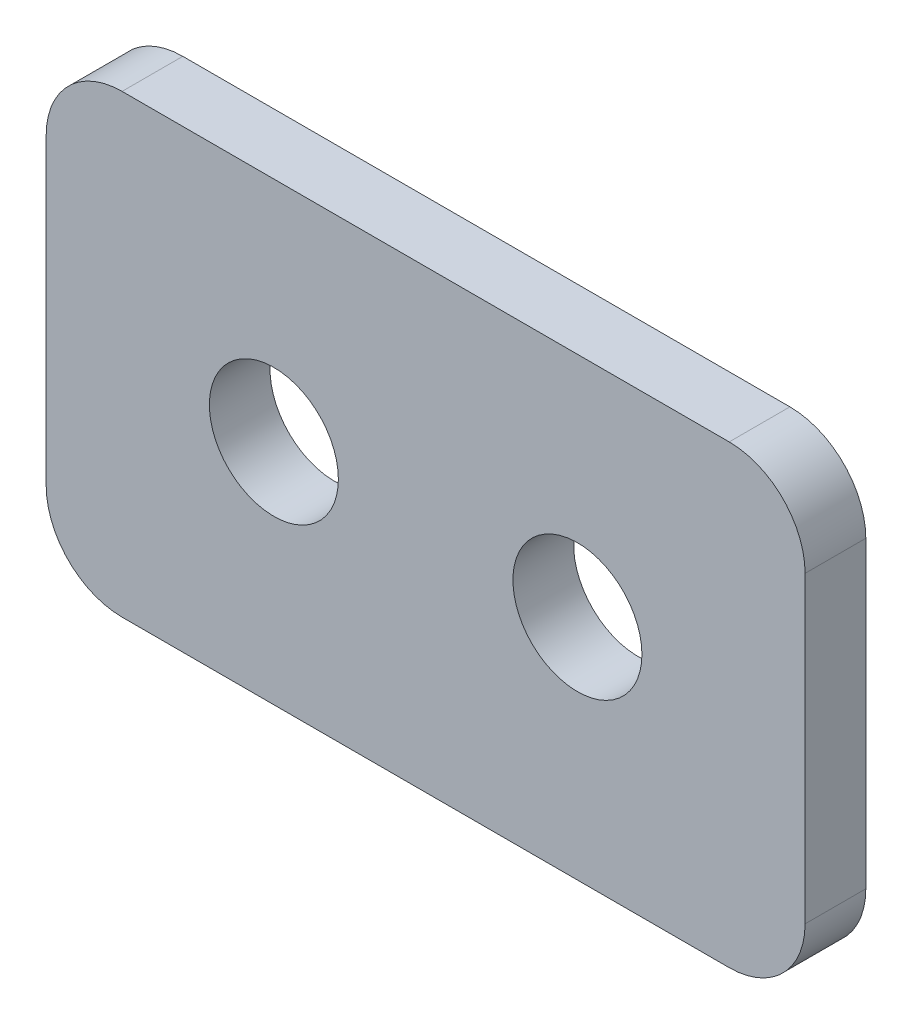
from build123d import *

# Parameters (mm, degrees)
SKETCH1_R          = 4.25
BASE_FLANGE1_DEPTH = 4


# Sheet-metal steps are written as plain solids
with BuildPart() as part:
    # Sketch1 → Base-Flange1 (new body)
    with BuildSketch(Plane.XY):
        with BuildLine():
            Line((-20, -15), (20, -15))
            ThreePointArc((20, -15), (23.535533906, -13.535533906), (25, -10))
            Line((25, -10), (25, 10))
            ThreePointArc((25, 10), (23.535533906, 13.535533906), (20, 15))
            Line((20, 15), (-20, 15))
            ThreePointArc((-20, 15), (-23.535533906, 13.535533906), (-25, 10))
            Line((-25, 10), (-25, -10))
            ThreePointArc((-25, -10), (-23.535533906, -13.535533906), (-20, -15))
        make_face()
        with Locations((-10, 0)):
            Circle(SKETCH1_R, mode=Mode.SUBTRACT)
        with Locations((10, 0)):
            Circle(SKETCH1_R, mode=Mode.SUBTRACT)
    extrude(amount=-BASE_FLANGE1_DEPTH)


solid = part.part
